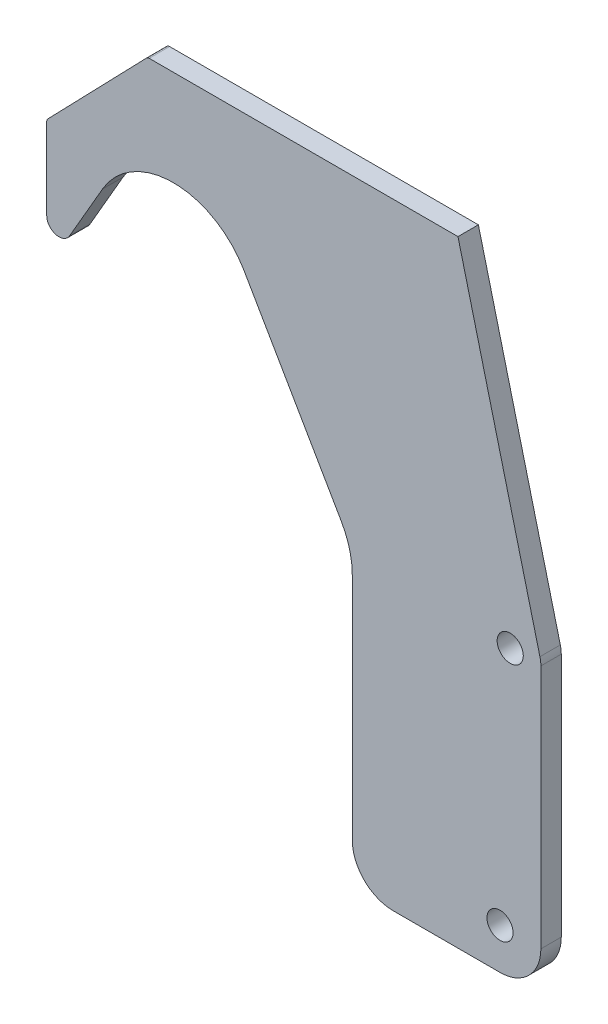
from build123d import *

# Parameters (mm, degrees)
SKETCH1_R           = 2.032
BOSS_EXTRUDE1_DEPTH = 1.5875


with BuildPart() as part:
    # Sketch1 → Boss-Extrude1 (new, symmetric)
    with BuildSketch(Plane.XY):
        with BuildLine():
            Line((10.998522628, 23.8125), (26.121491242, -2.38125))
            ThreePointArc((26.121491242, -2.38125), (27.390226607, -5.444248127), (27.822968614, -8.73125))
            Line((27.822968614, -8.73125), (27.822968614, -44.45))
            ThreePointArc((27.822968614, -44.45), (29.682840553, -48.940128061), (34.172968614, -50.8))
            Line((34.172968614, -50.8), (50.8, -50.8))
            ThreePointArc((50.8, -50.8), (55.290128061, -48.940128061), (57.15, -44.45))
            Line((57.15, -44.45), (57.15, -6.35))
            ThreePointArc((57.15, -6.35), (57.113247256, -5.759475556), (57.003556276, -5.178065398))
            Line((57.003556276, -5.178065398), (44.258433217, 45.022863221))
            Line((44.258433217, 45.022863221), (-3.760990725, 45.022863221))
            ThreePointArc((-3.760990725, 45.022863221), (-3.984639138, 44.977402747), (-4.172791598, 44.848236501))
            Line((-4.172791598, 44.848236501), (-19.524882567, 28.973236501))
            ThreePointArc((-19.524882567, 28.973236501), (-19.644155062, 28.789786749), (-19.685944915, 28.575))
            Line((-19.685944915, 28.575), (-19.685944915, 15.875))
            ThreePointArc((-19.685944915, 15.875), (-18.273995196, 14.034911301), (-16.131166521, 14.9225))
            Line((-16.131166521, 14.9225), (-10.998522628, 23.8125))
            ThreePointArc((-10.998522628, 23.8125), (0, 30.1625), (10.998522628, 23.8125))
        make_face()
        with Locations((50.8, -44.45)):
            Circle(SKETCH1_R, mode=Mode.SUBTRACT)
        with Locations((52.3875, -6.35)):
            Circle(SKETCH1_R, mode=Mode.SUBTRACT)
    extrude(amount=BOSS_EXTRUDE1_DEPTH, both=True)


solid = part.part
